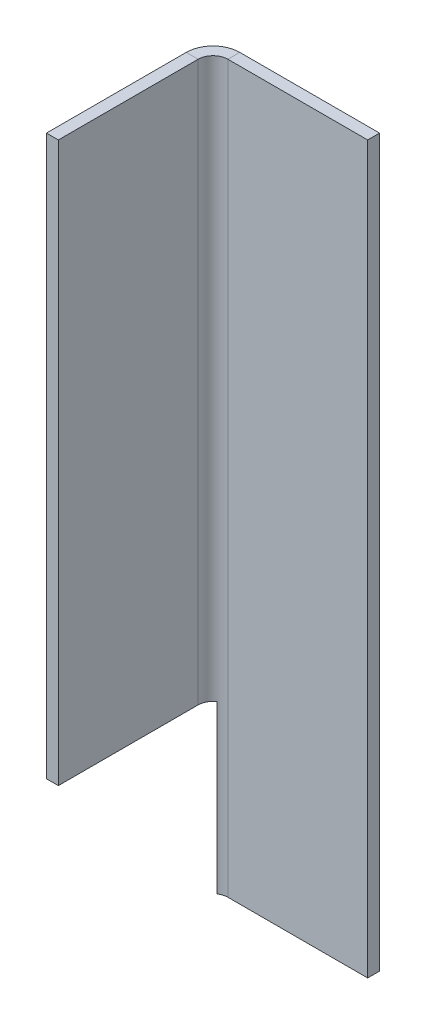
from build123d import *

# Parameters (mm, degrees)
SKETCH1_W                    = 28
SKETCH1_H                    = 122
BASE_FLANGE1_DEPTH           = 2
EDGE_FLANGE1_STRIP_W         = 13
EDGE_FLANGE1_STRIP_H         = 2
EDGE_FLANGE1_STRIP_CUT_DEPTH = 122
EDGE_FLANGE1_DEPTH           = 122
CUT_EXTRUDE1_START           = -61
CUT_EXTRUDE1_DEPTH           = 28


# Read off the part's stored shape, not the designer's step: Cut-Extrude1
# Sheet-metal steps are written as plain solids
with BuildPart() as part:
    # Sketch1 → Base-Flange1 (new body)
    with BuildSketch(Plane(origin=(0, 0, 0), x_dir=(0, 0, -1), z_dir=(1, 0, 0))):
        Rectangle(SKETCH1_W, SKETCH1_H)
    extrude(amount=-BASE_FLANGE1_DEPTH)

    # Edge-Flange1 strip (across the edge) → Edge-Flange1 strip cut (cut)
    with BuildSketch(Plane(origin=(0, -61, -14), x_dir=(0, 0, 1), z_dir=(0, 1, 0))):
        with Locations((-2, -1)):
            Rectangle(EDGE_FLANGE1_STRIP_W, EDGE_FLANGE1_STRIP_H)
    extrude(amount=EDGE_FLANGE1_STRIP_CUT_DEPTH, mode=Mode.SUBTRACT)

    # Edge-Flange1 section (across the edge) → Edge-Flange1 (add)
    with BuildSketch(Plane(origin=(0, -61, -14), x_dir=(0, 0, 1), z_dir=(0, 1, 0))):
        with BuildLine():
            Line((0, 2.5), (0, 26))
            Line((0, 26), (2, 26))
            Line((2, 26), (2, 2.5))
            ThreePointArc((2, 2.5), (2.732233047, 0.732233047), (4.5, 0))
            Line((4.5, 0), (4.5, -2))
            ThreePointArc((4.5, -2), (1.318019485, -0.681980515), (0, 2.5))
        make_face()
    extrude(amount=EDGE_FLANGE1_DEPTH)

    # Cut-Extrude1 outline → Cut-Extrude1 (cut)
    with BuildSketch(Plane(origin=(0, 0, 0), x_dir=(1, 0, 0), z_dir=(0, 1, 0)).offset(CUT_EXTRUDE1_START)):
        with BuildLine():
            Line((1.111111111, 11.578698548), (0, 13.241657386))
            ThreePointArc((0, 13.241657386), (-1.468626966, 11.621320343), (-2, 9.5))
            Line((-2, 9.5), (-2, -14))
            Line((-2, -14), (0, -14))
            Line((0, -14), (0, 9.5))
            ThreePointArc((0, 9.5), (0.295207241, 10.678511302), (1.111111111, 11.578698548))
        make_face()
    extrude(amount=CUT_EXTRUDE1_DEPTH, mode=Mode.SUBTRACT)


solid = part.part
